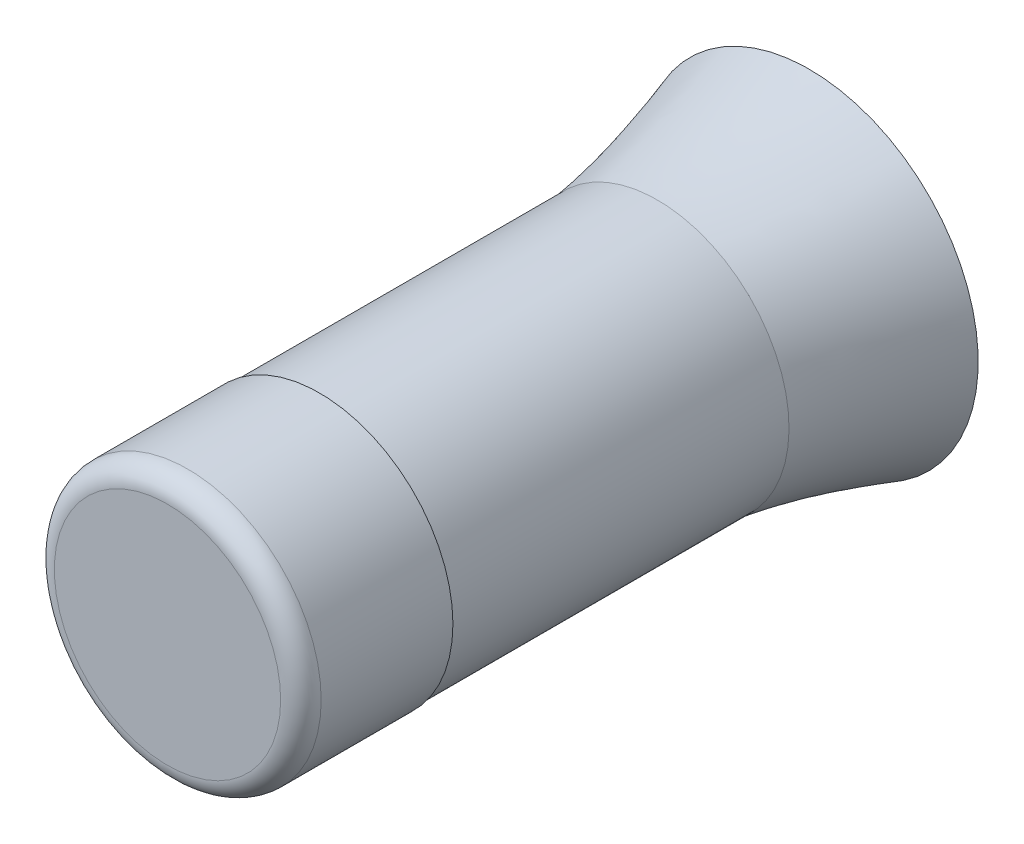
from build123d import *

# Parameters (mm, degrees)
SKETCH_1_R      = 1.95
EXTRUDE_1_DEPTH = 5
SKETCH_4_R      = 1.975
EXTRUDE_2_DEPTH = 2.25
FILLET_1_R      = 0.3


with BuildPart() as part:
    # 스케치1 → 보스-돌출1 (new body)
    with BuildSketch(Plane.XY):
        Circle(SKETCH_1_R)
    extrude(amount=EXTRUDE_1_DEPTH)

    # 로프트1: read off the stored shape, not the designer's step
    # 로프트1: loft between two sections, ruled curve by curve
    loft_1_from = [
        Edge.make_bspline([(1.357909549, 1.399493357, 0), (4.156896263, -1.316325741, 0), (1.441077165, -4.115312455, 0), (-1.357909549, -1.399493357, 0), (-4.156896263, 1.316325741, 0), (-1.441077165, 4.115312455, 0), (1.357909549, 1.399493357, 0)], [0, 0, 0, 0, 0.5, 0.5, 0.5, 1, 1, 1, 1], 3, [1, 0.333333333, 0.333333333, 1, 0.333333333, 0.333333333, 1]),
    ]
    loft_1_to = [
        Edge.make_bspline([(2.341374717, 0.8763358, -2.25), (4.094046318, -3.806413633, -2.25), (-0.588703116, -5.559085234, -2.25), (-2.341374717, -0.8763358, -2.25), (-4.094046318, 3.806413633, -2.25), (0.588703116, 5.559085234, -2.25), (2.341374717, 0.8763358, -2.25)], [0, 0, 0, 0, 0.5, 0.5, 0.5, 1, 1, 1, 1], 3, [1, 0.333333333, 0.333333333, 1, 0.333333333, 0.333333333, 1]),
    ]
    loft_1 = Solid(Shell([*[Face.make_surface_from_curves(loft_1_from[k], loft_1_to[k]) for k in range(1)], Face(Wire(loft_1_from)), Face(Wire(loft_1_to))]))
    add(loft_1)

    # 스케치4 → 보스-돌출2 (add)
    with BuildSketch(Plane.XY.offset(5)):
        Circle(SKETCH_4_R)
    extrude(amount=EXTRUDE_2_DEPTH)

    # 필렛1
    fillet_1_edges = [part.edges().sort_by_distance(p)[0] for p in [
        (-1.975, 0, 7.25),
    ]]
    fillet(fillet_1_edges, radius=FILLET_1_R)


solid = part.part
